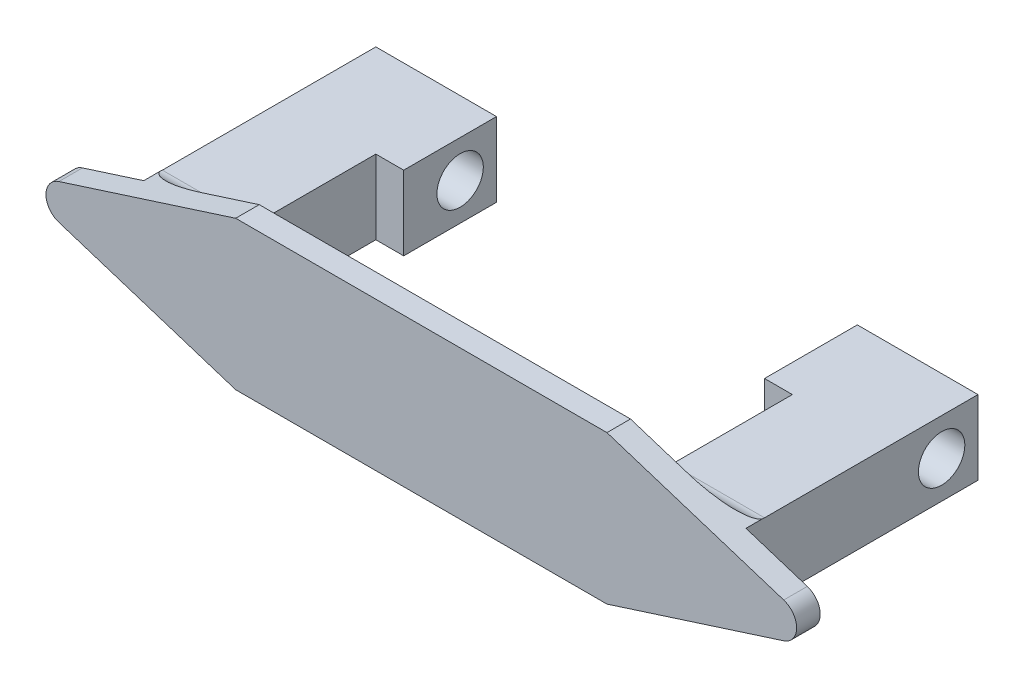
from build123d import *

# Parameters (mm, degrees)
BOSS_EXTRUDE1_DEPTH     = 1.27
FILLET1_R               = 2
BOSS_EXTRUDE2_DEPTH     = 4
CUT_EXTRUDE1_DEPTH      = 49.880756713
CUT_EXTRUDE1_DEPTH_BACK = 49.880756713
SKETCH3_R               = 2.5
FILLET2_R               = 2


with BuildPart() as part:
    # Sketch1 → Boss-Extrude1 (new, symmetric)
    with BuildSketch(Plane.XY):
        Polygon((-45, 0), (-20, 8), (20, 8), (45, 0), (20, -8), (-20, -8), align=None)
    extrude(amount=BOSS_EXTRUDE1_DEPTH, both=True)

    # Fillet1
    fillet1_edges = [part.edges().sort_by_distance(p)[0] for p in [
        (-45, 0, 0),
        (45, 0, 0),
    ]]
    fillet(fillet1_edges, radius=FILLET1_R)

    # Sketch2 → Boss-Extrude2 (add, symmetric)
    with BuildSketch(Plane(origin=(0, 0, 0), x_dir=(1, 0, 0), z_dir=(0, 1, 0))):
        Polygon((-32.437797626, 1.27), (-32.437797626, 26.27), (-19.437797626, 26.27), (-19.437797626, 16.27), (-22.437797626, 16.27), (-22.437797626, 1.27), align=None)
        Polygon((22.437797626, 16.27), (22.437797626, 1.27), (32.437797626, 1.27), (32.437797626, 26.27), (19.437797626, 26.27), (19.437797626, 16.27), align=None)
    extrude(amount=BOSS_EXTRUDE2_DEPTH, both=True)

    # Sketch3 → Cut-Extrude1 (cut, two sides: drawn at the far end of the back side and taken through both)
    with BuildSketch(Plane(origin=(0, 0, 0), x_dir=(0, 0, -1), z_dir=(1, 0, 0)).offset(-CUT_EXTRUDE1_DEPTH_BACK)):
        with Locations((22.350351111, 0)):
            Circle(SKETCH3_R)
    extrude(amount=CUT_EXTRUDE1_DEPTH + CUT_EXTRUDE1_DEPTH_BACK, mode=Mode.SUBTRACT)

    # Fillet2
    # the kernel refuses this fillet: 2 mm, written as the material it adds along each edge
    with BuildSketch(Plane(origin=(-22.437797626, -4, -1.27), x_dir=(0, -1, 0), z_dir=(-1, 0, 0))) as fillet2_piece_1_section:
        with BuildLine():
            CenterArc((FILLET2_R, -FILLET2_R), FILLET2_R, 90, 90)
            Line((0, -FILLET2_R), (0, 0))
            Line((0, 0), (FILLET2_R, 0))
        make_face()
    fillet2_piece_1 = extrude(amount=10, mode=Mode.PRIVATE)
    fillet2_piece_1 = split(fillet2_piece_1, bisect_by=Plane(origin=(-27.271019309, -5.673273821, -1.76186219), z_dir=(0.3047757271037839, 0.9524241471993241, 0)), keep=Keep.TOP, mode=Mode.PRIVATE)
    add(fillet2_piece_1)
    with BuildSketch(Plane(origin=(-22.437797626, -4, -1.27), x_dir=(1, 0, 0), z_dir=(0, 1, 0))) as fillet2_piece_2:
        with BuildLine():
            CenterArc((FILLET2_R, FILLET2_R), FILLET2_R, 180, 90)
            Line((0, FILLET2_R), (0, 0))
            Line((0, 0), (FILLET2_R, 0))
        make_face()
    extrude(amount=8)
    with BuildSketch(Plane(origin=(-22.437797626, 4, -1.27), x_dir=(0, 1, 0), z_dir=(-1, 0, 0))) as fillet2_piece_3_section:
        with BuildLine():
            CenterArc((FILLET2_R, FILLET2_R), FILLET2_R, 180, 90)
            Line((0, FILLET2_R), (0, 0))
            Line((0, 0), (FILLET2_R, 0))
        make_face()
    fillet2_piece_3 = extrude(amount=10, mode=Mode.PRIVATE)
    fillet2_piece_3 = split(fillet2_piece_3, bisect_by=Plane(origin=(-27.271019309, 5.673273821, -1.76186219), z_dir=(0.3047757271037837, -0.9524241471993242, 0)), keep=Keep.TOP, mode=Mode.PRIVATE)
    add(fillet2_piece_3)
    with BuildSketch(Plane(origin=(22.437797626, -4, -1.27), x_dir=(0, -1, 0), z_dir=(1, 0, 0))) as fillet2_piece_4_section:
        with BuildLine():
            CenterArc((FILLET2_R, FILLET2_R), FILLET2_R, 180, 90)
            Line((0, FILLET2_R), (0, 0))
            Line((0, 0), (FILLET2_R, 0))
        make_face()
    fillet2_piece_4 = extrude(amount=10, mode=Mode.PRIVATE)
    fillet2_piece_4 = split(fillet2_piece_4, bisect_by=Plane(origin=(27.271019309, -5.673273821, -1.76186219), z_dir=(-0.30477572710378414, 0.9524241471993241, 0)), keep=Keep.TOP, mode=Mode.PRIVATE)
    add(fillet2_piece_4)
    with BuildSketch(Plane(origin=(22.437797626, -4, -1.27), x_dir=(-1, 0, 0), z_dir=(0, 1, 0))) as fillet2_piece_5:
        with BuildLine():
            CenterArc((FILLET2_R, -FILLET2_R), FILLET2_R, 90, 90)
            Line((0, -FILLET2_R), (0, 0))
            Line((0, 0), (FILLET2_R, 0))
        make_face()
    extrude(amount=8)
    with BuildSketch(Plane(origin=(22.437797626, 4, -1.27), x_dir=(0, 1, 0), z_dir=(1, 0, 0))) as fillet2_piece_6_section:
        with BuildLine():
            CenterArc((FILLET2_R, -FILLET2_R), FILLET2_R, 90, 90)
            Line((0, -FILLET2_R), (0, 0))
            Line((0, 0), (FILLET2_R, 0))
        make_face()
    fillet2_piece_6 = extrude(amount=10, mode=Mode.PRIVATE)
    fillet2_piece_6 = split(fillet2_piece_6, bisect_by=Plane(origin=(27.271019309, 5.673273821, -1.76186219), z_dir=(-0.30477572710378353, -0.9524241471993244, 0)), keep=Keep.TOP, mode=Mode.PRIVATE)
    add(fillet2_piece_6)
    with BuildSketch(Plane(origin=(-22.437797626, -9, -1.27), x_dir=(1, 0, 0), z_dir=(0, 1, 0))) as fillet2_piece_7a_section:
        with BuildLine():
            CenterArc((FILLET2_R, FILLET2_R), FILLET2_R, 180, 90)
            Line((0, FILLET2_R), (0, 0))
            Line((0, 0), (FILLET2_R, 0))
        make_face()
    fillet2_piece_7a = extrude(amount=13, mode=Mode.PRIVATE)
    fillet2_piece_7a = split(fillet2_piece_7a, bisect_by=Plane(origin=(-22.456507994, -7.213917442, -1.712345443), z_dir=(0.3047757271037839, 0.9524241471993241, 0)), keep=Keep.TOP, mode=Mode.PRIVATE)
    fillet2_piece_7a = split(fillet2_piece_7a, bisect_by=Plane(origin=(-21.967327257, -4, -1.712345443), z_dir=(0, -1, 0)), keep=Keep.TOP, mode=Mode.PRIVATE)
    with BuildSketch(Plane(origin=(-17.437797626, -4, -1.27), x_dir=(0, -1, 0), z_dir=(-1, 0, 0))) as fillet2_piece_7b_section:
        with BuildLine():
            CenterArc((FILLET2_R, -FILLET2_R), FILLET2_R, 90, 90)
            Line((0, -FILLET2_R), (0, 0))
            Line((0, 0), (FILLET2_R, 0))
        make_face()
    fillet2_piece_7b = extrude(amount=15, mode=Mode.PRIVATE)
    fillet2_piece_7b = split(fillet2_piece_7b, bisect_by=Plane(origin=(-22.437797626, -4.452790229, -1.722790229), z_dir=(1, 0, 0)), keep=Keep.TOP, mode=Mode.PRIVATE)
    fillet2_piece_7 = fillet2_piece_7a & fillet2_piece_7b
    add(fillet2_piece_7)
    with BuildSketch(Plane(origin=(-17.437797626, 4, -1.27), x_dir=(0, 1, 0), z_dir=(-1, 0, 0))) as fillet2_piece_8a_section:
        with BuildLine():
            CenterArc((FILLET2_R, FILLET2_R), FILLET2_R, 180, 90)
            Line((0, FILLET2_R), (0, 0))
            Line((0, 0), (FILLET2_R, 0))
        make_face()
    fillet2_piece_8a = extrude(amount=15, mode=Mode.PRIVATE)
    fillet2_piece_8a = split(fillet2_piece_8a, bisect_by=Plane(origin=(-22.437797626, 4.452790229, -1.722790229), z_dir=(1, 0, 0)), keep=Keep.TOP, mode=Mode.PRIVATE)
    with BuildSketch(Plane(origin=(-22.437797626, -4, -1.27), x_dir=(1, 0, 0), z_dir=(0, 1, 0))) as fillet2_piece_8b_section:
        with BuildLine():
            CenterArc((FILLET2_R, FILLET2_R), FILLET2_R, 180, 90)
            Line((0, FILLET2_R), (0, 0))
            Line((0, 0), (FILLET2_R, 0))
        make_face()
    fillet2_piece_8b = extrude(amount=13, mode=Mode.PRIVATE)
    fillet2_piece_8b = split(fillet2_piece_8b, bisect_by=Plane(origin=(-22.456507994, 7.213917442, -1.712345443), z_dir=(0.3047757271037837, -0.9524241471993242, 0)), keep=Keep.TOP, mode=Mode.PRIVATE)
    fillet2_piece_8b = split(fillet2_piece_8b, bisect_by=Plane(origin=(-21.967327257, 4, -1.712345443), z_dir=(0, 1, 0)), keep=Keep.TOP, mode=Mode.PRIVATE)
    fillet2_piece_8 = fillet2_piece_8a & fillet2_piece_8b
    add(fillet2_piece_8)
    with BuildSketch(Plane(origin=(22.437797626, -9, -1.27), x_dir=(-1, 0, 0), z_dir=(0, 1, 0))) as fillet2_piece_9a_section:
        with BuildLine():
            CenterArc((FILLET2_R, -FILLET2_R), FILLET2_R, 90, 90)
            Line((0, -FILLET2_R), (0, 0))
            Line((0, 0), (FILLET2_R, 0))
        make_face()
    fillet2_piece_9a = extrude(amount=13, mode=Mode.PRIVATE)
    fillet2_piece_9a = split(fillet2_piece_9a, bisect_by=Plane(origin=(22.456507994, -7.213917442, -1.712345443), z_dir=(-0.30477572710378414, 0.9524241471993241, 0)), keep=Keep.TOP, mode=Mode.PRIVATE)
    fillet2_piece_9a = split(fillet2_piece_9a, bisect_by=Plane(origin=(21.967327257, -4, -1.712345443), z_dir=(0, -1, 0)), keep=Keep.TOP, mode=Mode.PRIVATE)
    with BuildSketch(Plane(origin=(17.437797626, -4, -1.27), x_dir=(0, -1, 0), z_dir=(1, 0, 0))) as fillet2_piece_9b_section:
        with BuildLine():
            CenterArc((FILLET2_R, FILLET2_R), FILLET2_R, 180, 90)
            Line((0, FILLET2_R), (0, 0))
            Line((0, 0), (FILLET2_R, 0))
        make_face()
    fillet2_piece_9b = extrude(amount=15, mode=Mode.PRIVATE)
    fillet2_piece_9b = split(fillet2_piece_9b, bisect_by=Plane(origin=(22.437797626, -4.452790229, -1.722790229), z_dir=(-1, 0, 0)), keep=Keep.TOP, mode=Mode.PRIVATE)
    fillet2_piece_9 = fillet2_piece_9a & fillet2_piece_9b
    add(fillet2_piece_9)
    with BuildSketch(Plane(origin=(22.437797626, -4, -1.27), x_dir=(-1, 0, 0), z_dir=(0, 1, 0))) as fillet2_piece_10a_section:
        with BuildLine():
            CenterArc((FILLET2_R, -FILLET2_R), FILLET2_R, 90, 90)
            Line((0, -FILLET2_R), (0, 0))
            Line((0, 0), (FILLET2_R, 0))
        make_face()
    fillet2_piece_10a = extrude(amount=13, mode=Mode.PRIVATE)
    fillet2_piece_10a = split(fillet2_piece_10a, bisect_by=Plane(origin=(22.456507994, 7.213917442, -1.712345443), z_dir=(-0.30477572710378353, -0.9524241471993244, 0)), keep=Keep.TOP, mode=Mode.PRIVATE)
    fillet2_piece_10a = split(fillet2_piece_10a, bisect_by=Plane(origin=(21.967327257, 4, -1.712345443), z_dir=(0, 1, 0)), keep=Keep.TOP, mode=Mode.PRIVATE)
    with BuildSketch(Plane(origin=(17.437797626, 4, -1.27), x_dir=(0, 1, 0), z_dir=(1, 0, 0))) as fillet2_piece_10b_section:
        with BuildLine():
            CenterArc((FILLET2_R, -FILLET2_R), FILLET2_R, 90, 90)
            Line((0, -FILLET2_R), (0, 0))
            Line((0, 0), (FILLET2_R, 0))
        make_face()
    fillet2_piece_10b = extrude(amount=15, mode=Mode.PRIVATE)
    fillet2_piece_10b = split(fillet2_piece_10b, bisect_by=Plane(origin=(22.437797626, 4.452790229, -1.722790229), z_dir=(-1, 0, 0)), keep=Keep.TOP, mode=Mode.PRIVATE)
    fillet2_piece_10 = fillet2_piece_10a & fillet2_piece_10b
    add(fillet2_piece_10)


solid = part.part
